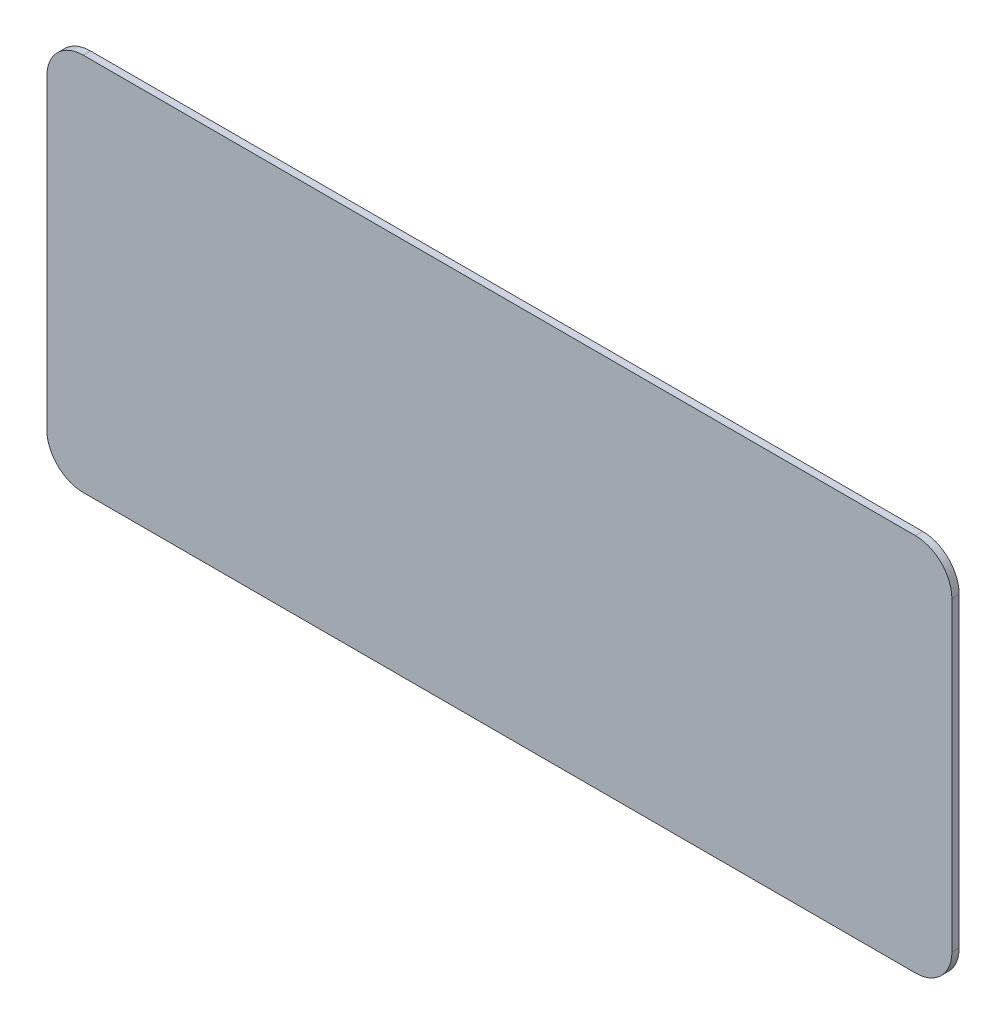
from build123d import *

# Parameters (mm, degrees)
SKETCH1_W           = 497
SKETCH1_H           = 208
BOSS_EXTRUDE1_DEPTH = 4
FILLET1_R           = 20


with BuildPart() as part:
    # Sketch1 → Boss-Extrude1 (new body)
    with BuildSketch(Plane.XY):
        Rectangle(SKETCH1_W, SKETCH1_H)
    extrude(amount=BOSS_EXTRUDE1_DEPTH)

    # Fillet1
    fillet1_edges = [part.edges().sort_by_distance(p)[0] for p in [
        (-248.5, -104, 2),
        (-248.5, 104, 2),
        (248.5, 104, 2),
        (248.5, -104, 2),
    ]]
    fillet(fillet1_edges, radius=FILLET1_R)


solid = part.part
